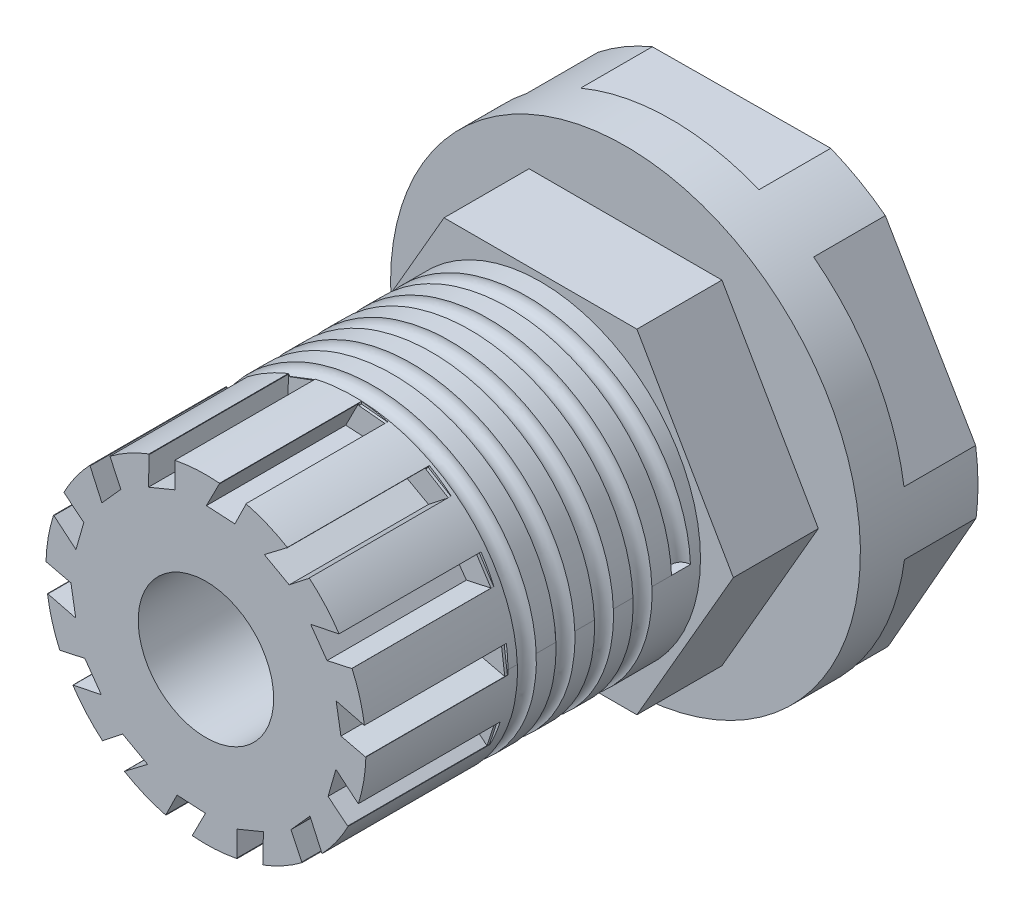
from build123d import *

# Parameters (mm, degrees)
SKETCH1_R           = 9.13
BOSS_EXTRUDE1_DEPTH = 19.09
SKETCH2_R           = 11.93
BOSS_EXTRUDE2_DEPTH = 4.85
SKETCH3_R           = 13.405
BOSS_EXTRUDE3_DEPTH = 6.71
SKETCH4_R           = 9.155
BOSS_EXTRUDE4_DEPTH = 1.85
SKETCH5_R           = 3.865
CUT_EXTRUDE1_DEPTH  = 35
SKETCH6_W           = 14.353900508
SKETCH6_H           = 2.400242131
CUT_EXTRUDE3_DEPTH  = 4.85
CIRPATTERN1_COUNT   = 6
CUT_EXTRUDE4_DEPTH  = 4.09
CIRPATTERN2_COUNT   = 6
CUT_SWEEP1_PITCH    = 2.2
FILLET1_R           = 1
CUT_EXTRUDE6_DEPTH  = 7.95
CUT_EXTRUDE7_DEPTH  = 8.1
CIRPATTERN3_COUNT   = 14
CIRPATTERN4_COUNT   = 14


with BuildPart() as part:
    # Sketch1 → Boss-Extrude1 (new body)
    with BuildSketch(Plane.XY):
        Circle(SKETCH1_R)
    extrude(amount=-BOSS_EXTRUDE1_DEPTH)

    # Sketch2 → Boss-Extrude2 (add)
    with BuildSketch(Plane(origin=(0, 0, -19.09), x_dir=(-1, 0, 0), z_dir=(0, 0, -1))):
        Circle(SKETCH2_R)
    extrude(amount=BOSS_EXTRUDE2_DEPTH)

    # Sketch3 → Boss-Extrude3 (add)
    with BuildSketch(Plane(origin=(0, 0, -23.94), x_dir=(-1, 0, 0), z_dir=(0, 0, -1))):
        Circle(SKETCH3_R)
    extrude(amount=BOSS_EXTRUDE3_DEPTH)

    # Sketch4 → Boss-Extrude4 (add)
    with BuildSketch(Plane(origin=(0, 0, -30.65), x_dir=(-1, 0, 0), z_dir=(0, 0, -1))):
        Circle(SKETCH4_R)
    extrude(amount=BOSS_EXTRUDE4_DEPTH)

    # Sketch5 → Cut-Extrude1 (cut)
    with BuildSketch(Plane.XY):
        Circle(SKETCH5_R)
    extrude(amount=-CUT_EXTRUDE1_DEPTH, mode=Mode.SUBTRACT)

    # Sketch6 → Cut-Extrude3 (cut)
    with BuildSketch(Plane.XY.offset(-19.09)):
        with Locations((0, 10.729878935)):
            Rectangle(SKETCH6_W, SKETCH6_H)
    cut_extrude3 = extrude(amount=-CUT_EXTRUDE3_DEPTH, mode=Mode.SUBTRACT)

    # CirPattern1: Cut-Extrude3 ×6 about axis
    cirpattern1_axis = Axis((0, 0, 0), (0, 0, 1))
    for i in range(1, CIRPATTERN1_COUNT):
        add(cut_extrude3.rotate(cirpattern1_axis, i * 360 / CIRPATTERN1_COUNT), mode=Mode.SUBTRACT)

    # Sketch8 → Cut-Extrude4 (cut)
    with BuildSketch(Plane(origin=(0, 0, -30.65), x_dir=(-1, 0, 0), z_dir=(0, 0, -1))):
        Polygon((-5.00156065, 12.436977771), (5.179818944, 12.363797989), (5.179818944, 14.661124616), (-5.21946303, 14.735870595), align=None)
    cut_extrude4 = extrude(amount=-CUT_EXTRUDE4_DEPTH, mode=Mode.SUBTRACT)

    # CirPattern2: Cut-Extrude4 ×6 about axis
    cirpattern2_axis = Axis((0, 0, 0), (0, 0, 1))
    for i in range(1, CIRPATTERN2_COUNT):
        add(cut_extrude4.rotate(cirpattern2_axis, i * 360 / CIRPATTERN2_COUNT), mode=Mode.SUBTRACT)

    # Cut-Sweep1: arcs per turn and ends read off the stored shape
    # Cut-Sweep1: the profile of Sketch12 screwed along a right-hand helix through 4.5 turns, 10 arcs to a turn; built about Z, then put on its axis
    cut_sweep1_z = Axis((0, 0, 0), (0, 0, 1))
    cut_sweep1_corners = [(-9.663092383, 0, 1.113451749), (-9.123192199, 0, 0.573551565), (-8.583292015, 0, 1.113451749), (-9.123192199, 0, 1.653351933)]
    with BuildLine(mode=Mode.PRIVATE) as cut_sweep1_profile:
        ThreePointArc((-9.663092383, 0, 1.113451749), (-9.50495928, 0, 0.731684668), (-9.123192199, 0, 0.573551565))
        ThreePointArc((-9.123192199, 0, 0.573551565), (-8.741425118, 0, 0.731684668), (-8.583292015, 0, 1.113451749))
        ThreePointArc((-8.583292015, 0, 1.113451749), (-8.741425118, 0, 1.49521883), (-9.123192199, 0, 1.653351933))
        ThreePointArc((-9.123192199, 0, 1.653351933), (-9.50495928, 0, 1.49521883), (-9.663092383, 0, 1.113451749))
    cut_sweep1_cap = Face(cut_sweep1_profile.wire())
    cut_sweep1_arcs = [((-9.663092383, 0, 1.113451749), (-9.663092383, 0, 0.573551565), (-9.123192199, 0, 0.573551565), (1, 0.7071067811865476, 1)), ((-9.123192199, 0, 0.573551565), (-8.583292015, 0, 0.573551565), (-8.583292015, 0, 1.113451749), (1, 0.7071067811865476, 1)), ((-8.583292015, 0, 1.113451749), (-8.583292015, 0, 1.653351933), (-9.123192199, 0, 1.653351933), (1, 0.7071067811865476, 1)), ((-9.123192199, 0, 1.653351933), (-9.663092383, 0, 1.653351933), (-9.663092383, 0, 1.113451749), (1, 0.7071067811865476, 1))]  # start, shoulder, end, weights
    cut_sweep1_turn_angles = [0, 18, 36, 54, 72, 90, 108, 126, 144, 162, 180, 198, 216, 234, 252, 270, 288, 306, 324, 342, 360]
    cut_sweep1_turn_weights = [1, 0.9510565162951535, 1, 0.9510565162951535, 1, 0.9510565162951535, 1, 0.9510565162951535, 1, 0.9510565162951535, 1, 0.9510565162951535, 1, 0.9510565162951535, 1, 0.9510565162951535, 1, 0.9510565162951535, 1, 0.9510565162951535, 1]
    cut_sweep1_turn_sides = [Face.make_bezier_surface([[Vector(p[j][0], p[j][1], 0).rotate(cut_sweep1_z, cut_sweep1_turn_angles[2 * i + k]) / cut_sweep1_turn_weights[2 * i + k] + Vector(0, 0, p[j][2] + CUT_SWEEP1_PITCH * cut_sweep1_turn_angles[2 * i + k] / 360) for k in range(3)] for j in range(3)], [[p[3][j] * cut_sweep1_turn_weights[2 * i + k] for k in range(3)] for j in range(3)]) for p in cut_sweep1_arcs for i in range(10)]
    cut_sweep1_last_angles = [1440, 1458, 1476, 1494, 1512, 1530, 1548, 1566, 1584, 1602, 1620]
    cut_sweep1_last_weights = [1, 0.9510565162951535, 1, 0.9510565162951535, 1, 0.9510565162951535, 1, 0.9510565162951535, 1, 0.9510565162951535, 1]
    cut_sweep1_last_sides = [Face.make_bezier_surface([[Vector(p[j][0], p[j][1], 0).rotate(cut_sweep1_z, cut_sweep1_last_angles[2 * i + k]) / cut_sweep1_last_weights[2 * i + k] + Vector(0, 0, p[j][2] + CUT_SWEEP1_PITCH * cut_sweep1_last_angles[2 * i + k] / 360) for k in range(3)] for j in range(3)], [[p[3][j] * cut_sweep1_last_weights[2 * i + k] for k in range(3)] for j in range(3)]) for p in cut_sweep1_arcs for i in range(5)]
    cut_sweep1 = Plane(origin=(0, 0, -19.09), x_dir=(-1, 0, 0), z_dir=(0, 0, 1)) * Solid(Shell([*[p.moved(Location((0, 0, CUT_SWEEP1_PITCH * i))) for i in range(4) for p in cut_sweep1_turn_sides], *cut_sweep1_last_sides, cut_sweep1_cap, cut_sweep1_cap.rotate(cut_sweep1_z, 1620).moved(Location((0, 0, CUT_SWEEP1_PITCH * 1620 / 360)))]))
    add(cut_sweep1, mode=Mode.SUBTRACT)

    # Fillet1
    fillet1_edges = [part.edges().sort_by_distance(p)[0] for p in [
        (9.155, 0, -32.5),
    ]]
    fillet(fillet1_edges, radius=FILLET1_R)

    # Sketch15 → Cut-Extrude6 (cut)
    with BuildSketch(Plane.XY):
        with BuildLine():
            Line((0.771265427, 9.071907804), (0.02743586, 7.615190011))
            Line((0.02743586, 7.615190011), (1.649430926, 7.524146452))
            Line((1.649430926, 7.524146452), (2.284224181, 8.814308642))
            ThreePointArc((2.284224181, 8.814308642), (1.531949594, 8.967804245), (0.771265427, 9.071907804))
        make_face()
    cut_extrude6 = extrude(amount=-CUT_EXTRUDE6_DEPTH, mode=Mode.SUBTRACT)

    # Sketch16 → Cut-Extrude7 (cut)
    with BuildSketch(Plane.XY):
        Polygon((0.777038297, 9.168840268), (0.777038297, 8.958315993), (2.284224181, 8.814308642), (2.284224181, 9.168840268), align=None)
    cut_extrude7 = extrude(amount=-CUT_EXTRUDE7_DEPTH, mode=Mode.SUBTRACT)

    # CirPattern3: Cut-Extrude6 ×14 about axis
    cirpattern3_axis = Axis((0, 0, 0), (0, 0, 1))
    for i in range(1, CIRPATTERN3_COUNT):
        add(cut_extrude6.rotate(cirpattern3_axis, i * 360 / CIRPATTERN3_COUNT), mode=Mode.SUBTRACT)

    # CirPattern4: Cut-Extrude7 ×14 about axis
    cirpattern4_axis = Axis((0, 0, 0), (0, 0, 1))
    for i in range(1, CIRPATTERN4_COUNT):
        add(cut_extrude7.rotate(cirpattern4_axis, i * 360 / CIRPATTERN4_COUNT), mode=Mode.SUBTRACT)


solid = part.part
